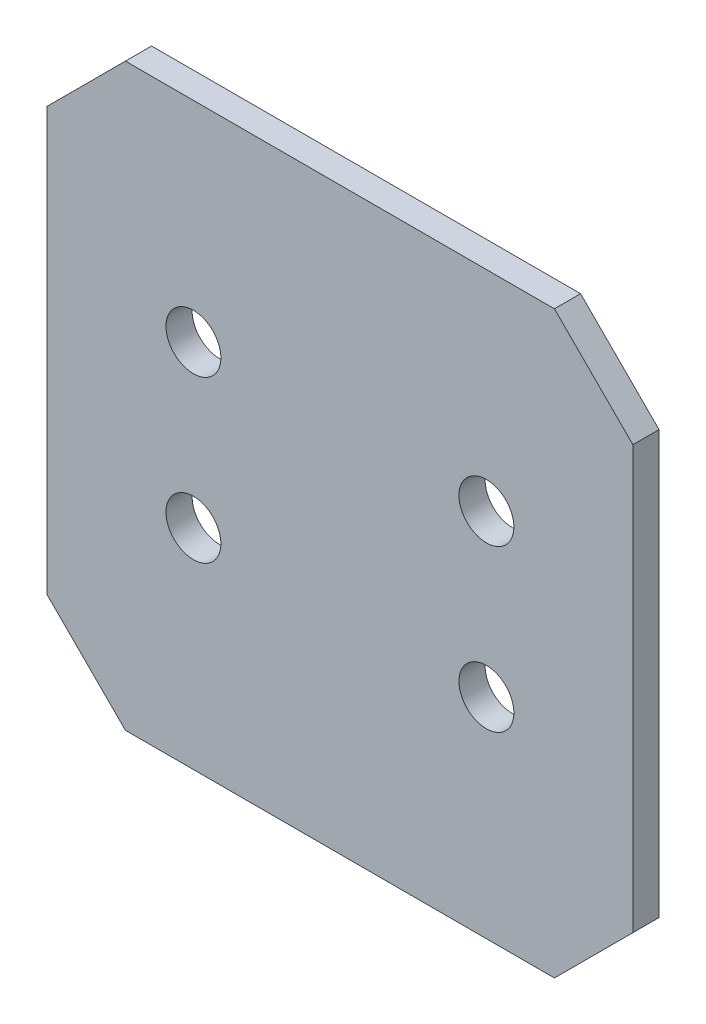
from build123d import *

# Parameters (mm, degrees)
SKETCH_1_W             = 112
SKETCH_1_H             = 110.77381068
SKETCH_1_R             = 5.25
SM_BASE_FLANGE_1_DEPTH = 5
CHAMFER_1_SIZE         = 15


# Sheet-metal steps are written as plain solids
with BuildPart() as part:
    # Sketch 1 → Базовая кромка1 (new body)
    with BuildSketch(Plane.XY):
        with Locations((0, 58.38690534)):
            Rectangle(SKETCH_1_W, SKETCH_1_H)
        with Locations((-28, 73.77381068)):
            Circle(SKETCH_1_R, mode=Mode.SUBTRACT)
        with Locations((-28, 43)):
            Circle(SKETCH_1_R, mode=Mode.SUBTRACT)
        with Locations(Location((28, 73.77381068, 0), (0, 0, 180))):
            Circle(SKETCH_1_R, mode=Mode.SUBTRACT)
        with Locations(Location((28, 43, 0), (0, 0, 180))):
            Circle(SKETCH_1_R, mode=Mode.SUBTRACT)
    extrude(amount=-SM_BASE_FLANGE_1_DEPTH)

    # Фаска1
    chamfer_1_edges = [part.edges().sort_by_distance(p)[0] for p in [
        (56, 3, -2.5),
        (-56, 3, -2.5),
        (-56, 113.77381068, -2.5),
        (56, 113.77381068, -2.5),
    ]]
    chamfer(chamfer_1_edges, length=CHAMFER_1_SIZE)


solid = part.part
